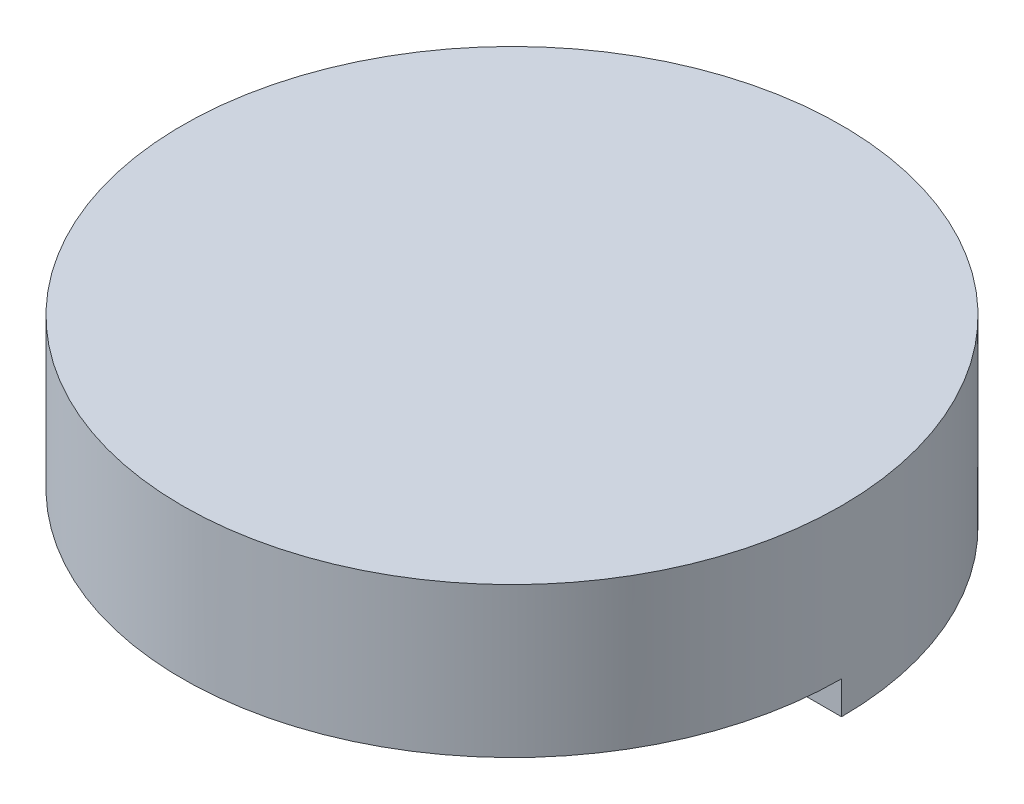
from build123d import *
from build123d.topology import SkipClean

# Parameters (mm, degrees)
SKETCH2_R           = 11
BOSS_EXTRUDE1_DEPTH = 5
BOSS_EXTRUDE2_START = -0.6
BOSS_EXTRUDE2_DEPTH = 0.6
BOSS_EXTRUDE3_START = 0.5
BOSS_EXTRUDE3_DEPTH = 0.5


with BuildPart() as part:
    # Sketch2 → Boss-Extrude1 (new body)
    with BuildSketch(Plane(origin=(0, 0, 0), x_dir=(1, 0, 0), z_dir=(0, 1, 0))):
        Circle(SKETCH2_R)
    extrude(amount=BOSS_EXTRUDE1_DEPTH)

    # Sketch3 → Boss-Extrude2 (add)
    with SkipClean():  # the faces are left unmerged after this step: merging them gives an invalid solid
        with BuildSketch(Plane(origin=(0, 0, 0), x_dir=(1, 0, 0), z_dir=(0, 1, 0)).offset(BOSS_EXTRUDE2_START)):
            with BuildLine():
                Line((-10, 0), (-11, 0))
                ThreePointArc((-11, 0), (0, 11), (11, 0))
                Line((11, 0), (10, 0))
                ThreePointArc((10, 0), (0, 10), (-10, 0))
            make_face()
        extrude(amount=BOSS_EXTRUDE2_DEPTH)

    # Sketch4 → Boss-Extrude3 (add)
    with SkipClean():  # the faces are left unmerged after this step: merging them gives an invalid solid
        with BuildSketch(Plane.XZ.offset(0.6).offset(BOSS_EXTRUDE3_START)):
            with BuildLine():
                Line((-11, 0), (-8.5, 0))
                ThreePointArc((-8.5, 0), (0, -8.5), (8.5, 0))
                Line((8.5, 0), (11, 0))
                ThreePointArc((11, 0), (0, -11), (-11, 0))
            make_face()
        extrude(amount=-BOSS_EXTRUDE3_DEPTH)


solid = part.part
